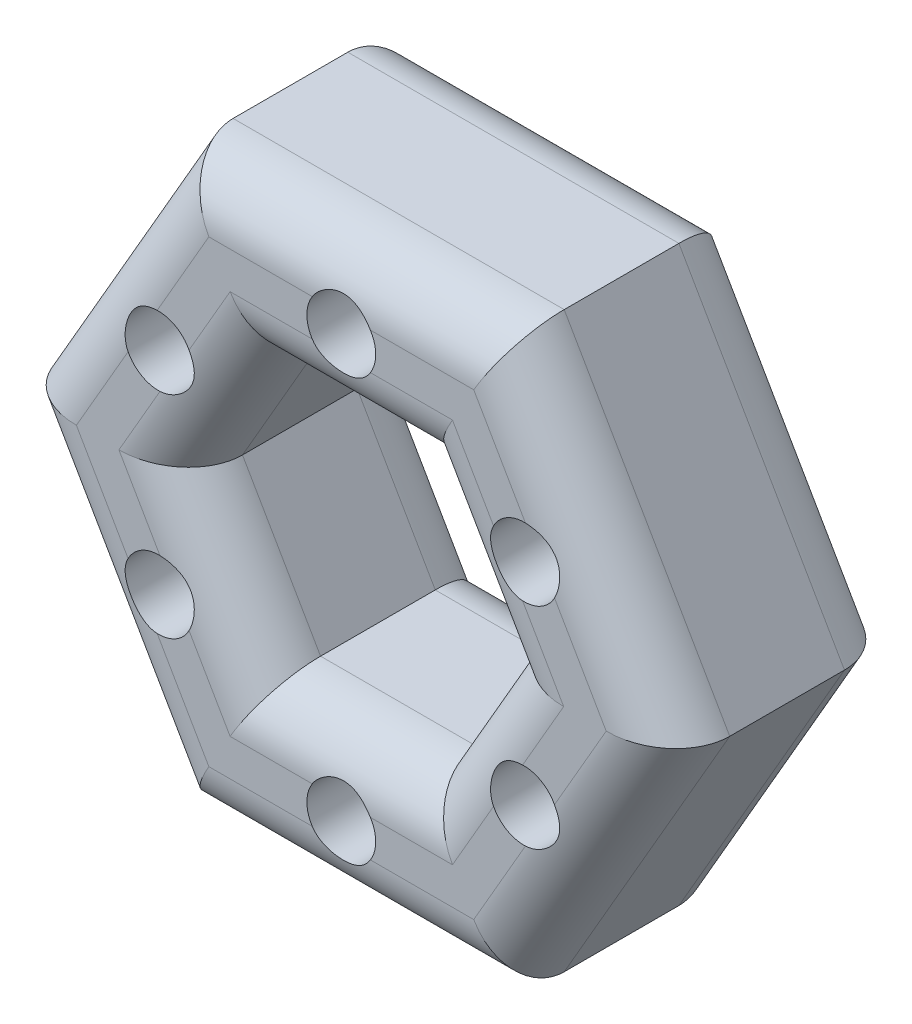
from build123d import *

# Parameters (mm, degrees)
SZKIC1_R                    = 6
DODANIE_WYCI_GNI_CIE1_DEPTH = 20
ZAOKR_GLENIE1_R             = 10


with BuildPart() as part:
    # Szkic1 → Dodanie-wyciągnięcie1 (new, symmetric)
    with BuildSketch(Plane.XY):
        Polygon((-28.867513459, 50), (28.867513459, 50), (57.735026919, 0), (28.867513459, -50), (-28.867513459, -50), (-57.735026919, 0), align=None)
        with Locations((0, 36.79)):
            Circle(SZKIC1_R, mode=Mode.SUBTRACT)
        with Locations((31.861074605, 18.395)):
            Circle(SZKIC1_R, mode=Mode.SUBTRACT)
        with Locations((31.861074605, -18.395)):
            Circle(SZKIC1_R, mode=Mode.SUBTRACT)
        with Locations((0, -36.79)):
            Circle(SZKIC1_R, mode=Mode.SUBTRACT)
        with Locations((-31.861074605, -18.395)):
            Circle(SZKIC1_R, mode=Mode.SUBTRACT)
        with Locations((-31.861074605, 18.395)):
            Circle(SZKIC1_R, mode=Mode.SUBTRACT)
        Polygon((-13.613919347, 23.58), (13.613919347, 23.58), (27.227838695, 0), (13.613919347, -23.58), (-13.613919347, -23.58), (-27.227838695, 0), align=None, mode=Mode.SUBTRACT)
    extrude(amount=DODANIE_WYCI_GNI_CIE1_DEPTH, both=True)

    # Zaokrąglenie1
    # the kernel refuses this fillet: 10 mm, written as the material it takes off along each edge
    with BuildSketch(Plane(origin=(53.867513459, -50, 20), x_dir=(0, 1, 0), z_dir=(-1, 0, 0)), Plane(origin=(70.235026919, 21.650635095, 20), x_dir=(-0.8660254037844363, 0.5000000000000041, 0), z_dir=(-0.5000000000000041, -0.8660254037844363, 0)), Plane(origin=(16.367513459, 71.650635095, 20), x_dir=(-0.8660254037844399, -0.4999999999999978, 0), z_dir=(0.49999999999999784, -0.8660254037844399, 0)), Plane(origin=(-70.235026919, -21.650635095, 20), x_dir=(0.8660254037844328, -0.5000000000000102, 0), z_dir=(0.5000000000000102, 0.8660254037844328, 0)), Plane(origin=(-53.867513459, 50, -20), x_dir=(0, 0, 1), z_dir=(1, 0, 0)), Plane(origin=(16.367513459, 71.650635095, -20), x_dir=(0, 0, 1), z_dir=(0.49999999999999784, -0.8660254037844399, 0)), Plane(origin=(70.235026919, 21.650635095, -20), x_dir=(0, 0, 1), z_dir=(-0.5000000000000041, -0.8660254037844363, 0)), Plane(origin=(-16.367513459, -71.650635095, 20), x_dir=(0.8660254037844433, 0.499999999999992, 0), z_dir=(-0.499999999999992, 0.8660254037844433, 0)), Plane(origin=(53.867513459, -50, -20), x_dir=(0, 0, 1), z_dir=(-1, 0, 0)), Plane(origin=(-16.367513459, -71.650635095, -20), x_dir=(0, 0, 1), z_dir=(-0.499999999999992, 0.8660254037844433, 0))) as zaokr_glenie1_piece_1:
        with BuildLine():
            CenterArc((ZAOKR_GLENIE1_R, ZAOKR_GLENIE1_R), ZAOKR_GLENIE1_R, 180, 90)
            Line((0, ZAOKR_GLENIE1_R), (0, 0))
            Line((0, 0), (ZAOKR_GLENIE1_R, 0))
        make_face()
    extrude(amount=107.735026919, mode=Mode.SUBTRACT)
    with BuildSketch(Plane(origin=(-53.867513459, 50, 20), x_dir=(0, 0, -1), z_dir=(1, 0, 0)), Plane(origin=(-70.235026919, -21.650635095, -20), x_dir=(0.8660254037844328, -0.5000000000000102, 0), z_dir=(0.5000000000000102, 0.8660254037844328, 0))) as zaokr_glenie1_piece_2:
        with BuildLine():
            CenterArc((ZAOKR_GLENIE1_R, -ZAOKR_GLENIE1_R), ZAOKR_GLENIE1_R, 90, 90)
            Line((0, -ZAOKR_GLENIE1_R), (0, 0))
            Line((0, 0), (ZAOKR_GLENIE1_R, 0))
        make_face()
    extrude(amount=107.735026919, mode=Mode.SUBTRACT)
    with BuildSketch(Plane(origin=(-39.727838695, -21.650635095, -20), x_dir=(0, 0, 1), z_dir=(0.5000000000000001, 0.8660254037844386, 0))) as zaokr_glenie1_piece_3_section:
        with BuildLine():
            CenterArc((ZAOKR_GLENIE1_R, -ZAOKR_GLENIE1_R), ZAOKR_GLENIE1_R, 90, 90)
            Line((0, -ZAOKR_GLENIE1_R), (0, 0))
            Line((0, 0), (ZAOKR_GLENIE1_R, 0))
        make_face()
    zaokr_glenie1_piece_3 = extrude(amount=77.227838695, mode=Mode.PRIVATE)
    zaokr_glenie1_piece_3 = split(zaokr_glenie1_piece_3, bisect_by=Plane(origin=(-22.192693606, 23.58, -17.607241167), z_dir=(0, -1, 0)), keep=Keep.TOP, mode=Mode.PRIVATE)
    zaokr_glenie1_piece_3 = split(zaokr_glenie1_piece_3, bisect_by=Plane(origin=(-31.517225824, 7.429436442, -17.607241167), z_dir=(0.8660254037844386, 0.5000000000000002, 0)), keep=Keep.TOP, mode=Mode.PRIVATE)
    add(zaokr_glenie1_piece_3, mode=Mode.SUBTRACT)
    with BuildSketch(Plane(origin=(-1.113919347, -45.230635095, -20), x_dir=(0, 0, 1), z_dir=(-0.5000000000000002, 0.8660254037844386, 0))) as zaokr_glenie1_piece_4_section:
        with BuildLine():
            CenterArc((ZAOKR_GLENIE1_R, -ZAOKR_GLENIE1_R), ZAOKR_GLENIE1_R, 90, 90)
            Line((0, -ZAOKR_GLENIE1_R), (0, 0))
            Line((0, 0), (ZAOKR_GLENIE1_R, 0))
        make_face()
    zaokr_glenie1_piece_4 = extrude(amount=77.227838695, mode=Mode.PRIVATE)
    zaokr_glenie1_piece_4 = split(zaokr_glenie1_piece_4, bisect_by=Plane(origin=(-22.192693606, -23.58, -17.607241167), z_dir=(0, 1, 0)), keep=Keep.TOP, mode=Mode.PRIVATE)
    zaokr_glenie1_piece_4 = split(zaokr_glenie1_piece_4, bisect_by=Plane(origin=(-31.517225824, -7.429436442, -17.607241167), z_dir=(0.8660254037844386, -0.5000000000000001, 0)), keep=Keep.TOP, mode=Mode.PRIVATE)
    add(zaokr_glenie1_piece_4, mode=Mode.SUBTRACT)
    with BuildSketch(Plane(origin=(38.613919347, -23.58, -20), x_dir=(0, 0, 1), z_dir=(-1, 0, 0))) as zaokr_glenie1_piece_5_section:
        with BuildLine():
            CenterArc((ZAOKR_GLENIE1_R, -ZAOKR_GLENIE1_R), ZAOKR_GLENIE1_R, 90, 90)
            Line((0, -ZAOKR_GLENIE1_R), (0, 0))
            Line((0, 0), (ZAOKR_GLENIE1_R, 0))
        make_face()
    zaokr_glenie1_piece_5 = extrude(amount=77.227838695, mode=Mode.PRIVATE)
    zaokr_glenie1_piece_5 = split(zaokr_glenie1_piece_5, bisect_by=Plane(origin=(9.324532218, -31.009436442, -17.607241167), z_dir=(-0.8660254037844386, 0.5000000000000001, 0)), keep=Keep.TOP, mode=Mode.PRIVATE)
    zaokr_glenie1_piece_5 = split(zaokr_glenie1_piece_5, bisect_by=Plane(origin=(-9.324532218, -31.009436442, -17.607241167), z_dir=(0.8660254037844386, 0.5000000000000002, 0)), keep=Keep.TOP, mode=Mode.PRIVATE)
    add(zaokr_glenie1_piece_5, mode=Mode.SUBTRACT)
    with BuildSketch(Plane(origin=(39.727838695, 21.650635095, -20), x_dir=(0, 0, 1), z_dir=(-0.5000000000000001, -0.8660254037844386, 0))) as zaokr_glenie1_piece_6_section:
        with BuildLine():
            CenterArc((ZAOKR_GLENIE1_R, -ZAOKR_GLENIE1_R), ZAOKR_GLENIE1_R, 90, 90)
            Line((0, -ZAOKR_GLENIE1_R), (0, 0))
            Line((0, 0), (ZAOKR_GLENIE1_R, 0))
        make_face()
    zaokr_glenie1_piece_6 = extrude(amount=77.227838695, mode=Mode.PRIVATE)
    zaokr_glenie1_piece_6 = split(zaokr_glenie1_piece_6, bisect_by=Plane(origin=(31.517225824, -7.429436442, -17.607241167), z_dir=(-0.8660254037844387, -0.5000000000000001, 0)), keep=Keep.TOP, mode=Mode.PRIVATE)
    zaokr_glenie1_piece_6 = split(zaokr_glenie1_piece_6, bisect_by=Plane(origin=(22.192693606, -23.58, -17.607241167), z_dir=(0, 1, 0)), keep=Keep.TOP, mode=Mode.PRIVATE)
    add(zaokr_glenie1_piece_6, mode=Mode.SUBTRACT)
    with BuildSketch(Plane(origin=(1.113919347, 45.230635095, -20), x_dir=(0, 0, 1), z_dir=(0.5000000000000001, -0.8660254037844387, 0))) as zaokr_glenie1_piece_7_section:
        with BuildLine():
            CenterArc((ZAOKR_GLENIE1_R, -ZAOKR_GLENIE1_R), ZAOKR_GLENIE1_R, 90, 90)
            Line((0, -ZAOKR_GLENIE1_R), (0, 0))
            Line((0, 0), (ZAOKR_GLENIE1_R, 0))
        make_face()
    zaokr_glenie1_piece_7 = extrude(amount=77.227838695, mode=Mode.PRIVATE)
    zaokr_glenie1_piece_7 = split(zaokr_glenie1_piece_7, bisect_by=Plane(origin=(22.192693606, 23.58, -17.607241167), z_dir=(0, -1, 0)), keep=Keep.TOP, mode=Mode.PRIVATE)
    zaokr_glenie1_piece_7 = split(zaokr_glenie1_piece_7, bisect_by=Plane(origin=(31.517225824, 7.429436442, -17.607241167), z_dir=(-0.8660254037844386, 0.5000000000000001, 0)), keep=Keep.TOP, mode=Mode.PRIVATE)
    add(zaokr_glenie1_piece_7, mode=Mode.SUBTRACT)
    with BuildSketch(Plane(origin=(-38.613919347, 23.58, -20), x_dir=(0, 0, 1), z_dir=(1, 0, 0))) as zaokr_glenie1_piece_8_section:
        with BuildLine():
            CenterArc((ZAOKR_GLENIE1_R, -ZAOKR_GLENIE1_R), ZAOKR_GLENIE1_R, 90, 90)
            Line((0, -ZAOKR_GLENIE1_R), (0, 0))
            Line((0, 0), (ZAOKR_GLENIE1_R, 0))
        make_face()
    zaokr_glenie1_piece_8 = extrude(amount=77.227838695, mode=Mode.PRIVATE)
    zaokr_glenie1_piece_8 = split(zaokr_glenie1_piece_8, bisect_by=Plane(origin=(-9.324532218, 31.009436442, -17.607241167), z_dir=(0.8660254037844386, -0.5000000000000001, 0)), keep=Keep.TOP, mode=Mode.PRIVATE)
    zaokr_glenie1_piece_8 = split(zaokr_glenie1_piece_8, bisect_by=Plane(origin=(9.324532218, 31.009436442, -17.607241167), z_dir=(-0.8660254037844387, -0.5000000000000001, 0)), keep=Keep.TOP, mode=Mode.PRIVATE)
    add(zaokr_glenie1_piece_8, mode=Mode.SUBTRACT)
    with BuildSketch(Plane(origin=(-39.727838695, -21.650635095, 20), x_dir=(-0.8660254037844385, 0.5000000000000001, 0), z_dir=(0.5000000000000001, 0.8660254037844386, 0))) as zaokr_glenie1_piece_9_section:
        with BuildLine():
            CenterArc((ZAOKR_GLENIE1_R, -ZAOKR_GLENIE1_R), ZAOKR_GLENIE1_R, 90, 90)
            Line((0, -ZAOKR_GLENIE1_R), (0, 0))
            Line((0, 0), (ZAOKR_GLENIE1_R, 0))
        make_face()
    zaokr_glenie1_piece_9 = extrude(amount=77.227838695, mode=Mode.PRIVATE)
    zaokr_glenie1_piece_9 = split(zaokr_glenie1_piece_9, bisect_by=Plane(origin=(-22.192693606, 23.58, 17.607241167), z_dir=(0, -1, 0)), keep=Keep.TOP, mode=Mode.PRIVATE)
    zaokr_glenie1_piece_9 = split(zaokr_glenie1_piece_9, bisect_by=Plane(origin=(-31.517225824, 7.429436442, 17.607241167), z_dir=(0.8660254037844386, 0.5000000000000002, 0)), keep=Keep.TOP, mode=Mode.PRIVATE)
    add(zaokr_glenie1_piece_9, mode=Mode.SUBTRACT)
    with BuildSketch(Plane(origin=(-1.113919347, -45.230635095, 20), x_dir=(-0.8660254037844385, -0.5000000000000002, 0), z_dir=(-0.5000000000000002, 0.8660254037844386, 0))) as zaokr_glenie1_piece_10_section:
        with BuildLine():
            CenterArc((ZAOKR_GLENIE1_R, -ZAOKR_GLENIE1_R), ZAOKR_GLENIE1_R, 90, 90)
            Line((0, -ZAOKR_GLENIE1_R), (0, 0))
            Line((0, 0), (ZAOKR_GLENIE1_R, 0))
        make_face()
    zaokr_glenie1_piece_10 = extrude(amount=77.227838695, mode=Mode.PRIVATE)
    zaokr_glenie1_piece_10 = split(zaokr_glenie1_piece_10, bisect_by=Plane(origin=(-22.192693606, -23.58, 17.607241167), z_dir=(0, 1, 0)), keep=Keep.TOP, mode=Mode.PRIVATE)
    zaokr_glenie1_piece_10 = split(zaokr_glenie1_piece_10, bisect_by=Plane(origin=(-31.517225824, -7.429436442, 17.607241167), z_dir=(0.8660254037844386, -0.5000000000000001, 0)), keep=Keep.TOP, mode=Mode.PRIVATE)
    add(zaokr_glenie1_piece_10, mode=Mode.SUBTRACT)
    with BuildSketch(Plane(origin=(38.613919347, -23.58, 20), x_dir=(0, -1, 0), z_dir=(-1, 0, 0))) as zaokr_glenie1_piece_11_section:
        with BuildLine():
            CenterArc((ZAOKR_GLENIE1_R, -ZAOKR_GLENIE1_R), ZAOKR_GLENIE1_R, 90, 90)
            Line((0, -ZAOKR_GLENIE1_R), (0, 0))
            Line((0, 0), (ZAOKR_GLENIE1_R, 0))
        make_face()
    zaokr_glenie1_piece_11 = extrude(amount=77.227838695, mode=Mode.PRIVATE)
    zaokr_glenie1_piece_11 = split(zaokr_glenie1_piece_11, bisect_by=Plane(origin=(9.324532218, -31.009436442, 17.607241167), z_dir=(-0.8660254037844386, 0.5000000000000001, 0)), keep=Keep.TOP, mode=Mode.PRIVATE)
    zaokr_glenie1_piece_11 = split(zaokr_glenie1_piece_11, bisect_by=Plane(origin=(-9.324532218, -31.009436442, 17.607241167), z_dir=(0.8660254037844386, 0.5000000000000002, 0)), keep=Keep.TOP, mode=Mode.PRIVATE)
    add(zaokr_glenie1_piece_11, mode=Mode.SUBTRACT)
    with BuildSketch(Plane(origin=(39.727838695, 21.650635095, 20), x_dir=(0.8660254037844385, -0.5000000000000001, 0), z_dir=(-0.5000000000000001, -0.8660254037844386, 0))) as zaokr_glenie1_piece_12_section:
        with BuildLine():
            CenterArc((ZAOKR_GLENIE1_R, -ZAOKR_GLENIE1_R), ZAOKR_GLENIE1_R, 90, 90)
            Line((0, -ZAOKR_GLENIE1_R), (0, 0))
            Line((0, 0), (ZAOKR_GLENIE1_R, 0))
        make_face()
    zaokr_glenie1_piece_12 = extrude(amount=77.227838695, mode=Mode.PRIVATE)
    zaokr_glenie1_piece_12 = split(zaokr_glenie1_piece_12, bisect_by=Plane(origin=(31.517225824, -7.429436442, 17.607241167), z_dir=(-0.8660254037844387, -0.5000000000000001, 0)), keep=Keep.TOP, mode=Mode.PRIVATE)
    zaokr_glenie1_piece_12 = split(zaokr_glenie1_piece_12, bisect_by=Plane(origin=(22.192693606, -23.58, 17.607241167), z_dir=(0, 1, 0)), keep=Keep.TOP, mode=Mode.PRIVATE)
    add(zaokr_glenie1_piece_12, mode=Mode.SUBTRACT)
    with BuildSketch(Plane(origin=(1.113919347, 45.230635095, 20), x_dir=(0.8660254037844386, 0.5, 0), z_dir=(0.5000000000000001, -0.8660254037844387, 0))) as zaokr_glenie1_piece_13_section:
        with BuildLine():
            CenterArc((ZAOKR_GLENIE1_R, -ZAOKR_GLENIE1_R), ZAOKR_GLENIE1_R, 90, 90)
            Line((0, -ZAOKR_GLENIE1_R), (0, 0))
            Line((0, 0), (ZAOKR_GLENIE1_R, 0))
        make_face()
    zaokr_glenie1_piece_13 = extrude(amount=77.227838695, mode=Mode.PRIVATE)
    zaokr_glenie1_piece_13 = split(zaokr_glenie1_piece_13, bisect_by=Plane(origin=(22.192693606, 23.58, 17.607241167), z_dir=(0, -1, 0)), keep=Keep.TOP, mode=Mode.PRIVATE)
    zaokr_glenie1_piece_13 = split(zaokr_glenie1_piece_13, bisect_by=Plane(origin=(31.517225824, 7.429436442, 17.607241167), z_dir=(-0.8660254037844386, 0.5000000000000001, 0)), keep=Keep.TOP, mode=Mode.PRIVATE)
    add(zaokr_glenie1_piece_13, mode=Mode.SUBTRACT)
    with BuildSketch(Plane(origin=(-38.613919347, 23.58, 20), x_dir=(0, 1, 0), z_dir=(1, 0, 0))) as zaokr_glenie1_piece_14_section:
        with BuildLine():
            CenterArc((ZAOKR_GLENIE1_R, -ZAOKR_GLENIE1_R), ZAOKR_GLENIE1_R, 90, 90)
            Line((0, -ZAOKR_GLENIE1_R), (0, 0))
            Line((0, 0), (ZAOKR_GLENIE1_R, 0))
        make_face()
    zaokr_glenie1_piece_14 = extrude(amount=77.227838695, mode=Mode.PRIVATE)
    zaokr_glenie1_piece_14 = split(zaokr_glenie1_piece_14, bisect_by=Plane(origin=(-9.324532218, 31.009436442, 17.607241167), z_dir=(0.8660254037844386, -0.5000000000000001, 0)), keep=Keep.TOP, mode=Mode.PRIVATE)
    zaokr_glenie1_piece_14 = split(zaokr_glenie1_piece_14, bisect_by=Plane(origin=(9.324532218, 31.009436442, 17.607241167), z_dir=(-0.8660254037844387, -0.5000000000000001, 0)), keep=Keep.TOP, mode=Mode.PRIVATE)
    add(zaokr_glenie1_piece_14, mode=Mode.SUBTRACT)
    with BuildSketch(Plane(origin=(-1.113919347, -45.230635095, -20), x_dir=(0, 0, 1), z_dir=(-0.5000000000000002, 0.8660254037844386, 0))) as zaokr_glenie1_piece_15a_section:
        with BuildLine():
            CenterArc((ZAOKR_GLENIE1_R, -ZAOKR_GLENIE1_R), ZAOKR_GLENIE1_R, 90, 90)
            Line((0, -ZAOKR_GLENIE1_R), (0, 0))
            Line((0, 0), (ZAOKR_GLENIE1_R, 0))
        make_face()
    zaokr_glenie1_piece_15a = extrude(amount=77.227838695, mode=Mode.PRIVATE)
    zaokr_glenie1_piece_15a = split(zaokr_glenie1_piece_15a, bisect_by=Plane(origin=(-25.29807353, 3.342451312, -17.796306899), z_dir=(-0.8660254037844386, 0.5000000000000001, 0)), keep=Keep.TOP, mode=Mode.PRIVATE)
    with BuildSketch(Plane(origin=(-39.727838695, -21.650635095, -20), x_dir=(0, 0, 1), z_dir=(0.5000000000000001, 0.8660254037844386, 0))) as zaokr_glenie1_piece_15b_section:
        with BuildLine():
            CenterArc((ZAOKR_GLENIE1_R, -ZAOKR_GLENIE1_R), ZAOKR_GLENIE1_R, 90, 90)
            Line((0, -ZAOKR_GLENIE1_R), (0, 0))
            Line((0, 0), (ZAOKR_GLENIE1_R, 0))
        make_face()
    zaokr_glenie1_piece_15b = extrude(amount=77.227838695, mode=Mode.PRIVATE)
    zaokr_glenie1_piece_15b = split(zaokr_glenie1_piece_15b, bisect_by=Plane(origin=(-25.29807353, -3.342451312, -17.796306899), z_dir=(-0.8660254037844386, -0.5000000000000002, 0)), keep=Keep.TOP, mode=Mode.PRIVATE)
    zaokr_glenie1_piece_15 = zaokr_glenie1_piece_15a & zaokr_glenie1_piece_15b
    add(zaokr_glenie1_piece_15, mode=Mode.SUBTRACT)
    with BuildSketch(Plane(origin=(-38.613919347, 23.58, -20), x_dir=(0, 0, 1), z_dir=(1, 0, 0))) as zaokr_glenie1_piece_16a_section:
        with BuildLine():
            CenterArc((ZAOKR_GLENIE1_R, -ZAOKR_GLENIE1_R), ZAOKR_GLENIE1_R, 90, 90)
            Line((0, -ZAOKR_GLENIE1_R), (0, 0))
            Line((0, 0), (ZAOKR_GLENIE1_R, 0))
        make_face()
    zaokr_glenie1_piece_16a = extrude(amount=77.227838695, mode=Mode.PRIVATE)
    zaokr_glenie1_piece_16a = split(zaokr_glenie1_piece_16a, bisect_by=Plane(origin=(-15.543684512, 20.237548688, -17.796306899), z_dir=(-0.8660254037844386, 0.5000000000000001, 0)), keep=Keep.TOP, mode=Mode.PRIVATE)
    with BuildSketch(Plane(origin=(-39.727838695, -21.650635095, -20), x_dir=(0, 0, 1), z_dir=(0.5000000000000001, 0.8660254037844386, 0))) as zaokr_glenie1_piece_16b_section:
        with BuildLine():
            CenterArc((ZAOKR_GLENIE1_R, -ZAOKR_GLENIE1_R), ZAOKR_GLENIE1_R, 90, 90)
            Line((0, -ZAOKR_GLENIE1_R), (0, 0))
            Line((0, 0), (ZAOKR_GLENIE1_R, 0))
        make_face()
    zaokr_glenie1_piece_16b = extrude(amount=77.227838695, mode=Mode.PRIVATE)
    zaokr_glenie1_piece_16b = split(zaokr_glenie1_piece_16b, bisect_by=Plane(origin=(-9.754389018, 23.58, -17.796306899), z_dir=(0, 1, 0)), keep=Keep.TOP, mode=Mode.PRIVATE)
    zaokr_glenie1_piece_16 = zaokr_glenie1_piece_16a & zaokr_glenie1_piece_16b
    add(zaokr_glenie1_piece_16, mode=Mode.SUBTRACT)
    with BuildSketch(Plane(origin=(38.613919347, -23.58, -20), x_dir=(0, 0, 1), z_dir=(-1, 0, 0))) as zaokr_glenie1_piece_17a_section:
        with BuildLine():
            CenterArc((ZAOKR_GLENIE1_R, -ZAOKR_GLENIE1_R), ZAOKR_GLENIE1_R, 90, 90)
            Line((0, -ZAOKR_GLENIE1_R), (0, 0))
            Line((0, 0), (ZAOKR_GLENIE1_R, 0))
        make_face()
    zaokr_glenie1_piece_17a = extrude(amount=77.227838695, mode=Mode.PRIVATE)
    zaokr_glenie1_piece_17a = split(zaokr_glenie1_piece_17a, bisect_by=Plane(origin=(-15.543684512, -20.237548688, -17.796306899), z_dir=(-0.8660254037844386, -0.5000000000000002, 0)), keep=Keep.TOP, mode=Mode.PRIVATE)
    with BuildSketch(Plane(origin=(-1.113919347, -45.230635095, -20), x_dir=(0, 0, 1), z_dir=(-0.5000000000000002, 0.8660254037844386, 0))) as zaokr_glenie1_piece_17b_section:
        with BuildLine():
            CenterArc((ZAOKR_GLENIE1_R, -ZAOKR_GLENIE1_R), ZAOKR_GLENIE1_R, 90, 90)
            Line((0, -ZAOKR_GLENIE1_R), (0, 0))
            Line((0, 0), (ZAOKR_GLENIE1_R, 0))
        make_face()
    zaokr_glenie1_piece_17b = extrude(amount=77.227838695, mode=Mode.PRIVATE)
    zaokr_glenie1_piece_17b = split(zaokr_glenie1_piece_17b, bisect_by=Plane(origin=(-9.754389018, -23.58, -17.796306899), z_dir=(0, -1, 0)), keep=Keep.TOP, mode=Mode.PRIVATE)
    zaokr_glenie1_piece_17 = zaokr_glenie1_piece_17a & zaokr_glenie1_piece_17b
    add(zaokr_glenie1_piece_17, mode=Mode.SUBTRACT)
    with BuildSketch(Plane(origin=(39.727838695, 21.650635095, -20), x_dir=(0, 0, 1), z_dir=(-0.5000000000000001, -0.8660254037844386, 0))) as zaokr_glenie1_piece_18a_section:
        with BuildLine():
            CenterArc((ZAOKR_GLENIE1_R, -ZAOKR_GLENIE1_R), ZAOKR_GLENIE1_R, 90, 90)
            Line((0, -ZAOKR_GLENIE1_R), (0, 0))
            Line((0, 0), (ZAOKR_GLENIE1_R, 0))
        make_face()
    zaokr_glenie1_piece_18a = extrude(amount=77.227838695, mode=Mode.PRIVATE)
    zaokr_glenie1_piece_18a = split(zaokr_glenie1_piece_18a, bisect_by=Plane(origin=(9.754389018, -23.58, -17.796306899), z_dir=(0, -1, 0)), keep=Keep.TOP, mode=Mode.PRIVATE)
    with BuildSketch(Plane(origin=(38.613919347, -23.58, -20), x_dir=(0, 0, 1), z_dir=(-1, 0, 0))) as zaokr_glenie1_piece_18b_section:
        with BuildLine():
            CenterArc((ZAOKR_GLENIE1_R, -ZAOKR_GLENIE1_R), ZAOKR_GLENIE1_R, 90, 90)
            Line((0, -ZAOKR_GLENIE1_R), (0, 0))
            Line((0, 0), (ZAOKR_GLENIE1_R, 0))
        make_face()
    zaokr_glenie1_piece_18b = extrude(amount=77.227838695, mode=Mode.PRIVATE)
    zaokr_glenie1_piece_18b = split(zaokr_glenie1_piece_18b, bisect_by=Plane(origin=(15.543684512, -20.237548688, -17.796306899), z_dir=(0.8660254037844386, -0.5000000000000001, 0)), keep=Keep.TOP, mode=Mode.PRIVATE)
    zaokr_glenie1_piece_18 = zaokr_glenie1_piece_18a & zaokr_glenie1_piece_18b
    add(zaokr_glenie1_piece_18, mode=Mode.SUBTRACT)
    with BuildSketch(Plane(origin=(1.113919347, 45.230635095, -20), x_dir=(0, 0, 1), z_dir=(0.5000000000000001, -0.8660254037844387, 0))) as zaokr_glenie1_piece_19a_section:
        with BuildLine():
            CenterArc((ZAOKR_GLENIE1_R, -ZAOKR_GLENIE1_R), ZAOKR_GLENIE1_R, 90, 90)
            Line((0, -ZAOKR_GLENIE1_R), (0, 0))
            Line((0, 0), (ZAOKR_GLENIE1_R, 0))
        make_face()
    zaokr_glenie1_piece_19a = extrude(amount=77.227838695, mode=Mode.PRIVATE)
    zaokr_glenie1_piece_19a = split(zaokr_glenie1_piece_19a, bisect_by=Plane(origin=(25.29807353, -3.342451312, -17.796306899), z_dir=(0.8660254037844386, -0.5000000000000001, 0)), keep=Keep.TOP, mode=Mode.PRIVATE)
    with BuildSketch(Plane(origin=(39.727838695, 21.650635095, -20), x_dir=(0, 0, 1), z_dir=(-0.5000000000000001, -0.8660254037844386, 0))) as zaokr_glenie1_piece_19b_section:
        with BuildLine():
            CenterArc((ZAOKR_GLENIE1_R, -ZAOKR_GLENIE1_R), ZAOKR_GLENIE1_R, 90, 90)
            Line((0, -ZAOKR_GLENIE1_R), (0, 0))
            Line((0, 0), (ZAOKR_GLENIE1_R, 0))
        make_face()
    zaokr_glenie1_piece_19b = extrude(amount=77.227838695, mode=Mode.PRIVATE)
    zaokr_glenie1_piece_19b = split(zaokr_glenie1_piece_19b, bisect_by=Plane(origin=(25.29807353, 3.342451312, -17.796306899), z_dir=(0.8660254037844387, 0.5000000000000001, 0)), keep=Keep.TOP, mode=Mode.PRIVATE)
    zaokr_glenie1_piece_19 = zaokr_glenie1_piece_19a & zaokr_glenie1_piece_19b
    add(zaokr_glenie1_piece_19, mode=Mode.SUBTRACT)
    with BuildSketch(Plane(origin=(-38.613919347, 23.58, -20), x_dir=(0, 0, 1), z_dir=(1, 0, 0))) as zaokr_glenie1_piece_20a_section:
        with BuildLine():
            CenterArc((ZAOKR_GLENIE1_R, -ZAOKR_GLENIE1_R), ZAOKR_GLENIE1_R, 90, 90)
            Line((0, -ZAOKR_GLENIE1_R), (0, 0))
            Line((0, 0), (ZAOKR_GLENIE1_R, 0))
        make_face()
    zaokr_glenie1_piece_20a = extrude(amount=77.227838695, mode=Mode.PRIVATE)
    zaokr_glenie1_piece_20a = split(zaokr_glenie1_piece_20a, bisect_by=Plane(origin=(15.543684512, 20.237548688, -17.796306899), z_dir=(0.8660254037844387, 0.5000000000000001, 0)), keep=Keep.TOP, mode=Mode.PRIVATE)
    with BuildSketch(Plane(origin=(1.113919347, 45.230635095, -20), x_dir=(0, 0, 1), z_dir=(0.5000000000000001, -0.8660254037844387, 0))) as zaokr_glenie1_piece_20b_section:
        with BuildLine():
            CenterArc((ZAOKR_GLENIE1_R, -ZAOKR_GLENIE1_R), ZAOKR_GLENIE1_R, 90, 90)
            Line((0, -ZAOKR_GLENIE1_R), (0, 0))
            Line((0, 0), (ZAOKR_GLENIE1_R, 0))
        make_face()
    zaokr_glenie1_piece_20b = extrude(amount=77.227838695, mode=Mode.PRIVATE)
    zaokr_glenie1_piece_20b = split(zaokr_glenie1_piece_20b, bisect_by=Plane(origin=(9.754389018, 23.58, -17.796306899), z_dir=(0, 1, 0)), keep=Keep.TOP, mode=Mode.PRIVATE)
    zaokr_glenie1_piece_20 = zaokr_glenie1_piece_20a & zaokr_glenie1_piece_20b
    add(zaokr_glenie1_piece_20, mode=Mode.SUBTRACT)
    with BuildSketch(Plane(origin=(-39.727838695, -21.650635095, 20), x_dir=(-0.8660254037844385, 0.5000000000000001, 0), z_dir=(0.5000000000000001, 0.8660254037844386, 0))) as zaokr_glenie1_piece_21a_section:
        with BuildLine():
            CenterArc((ZAOKR_GLENIE1_R, -ZAOKR_GLENIE1_R), ZAOKR_GLENIE1_R, 90, 90)
            Line((0, -ZAOKR_GLENIE1_R), (0, 0))
            Line((0, 0), (ZAOKR_GLENIE1_R, 0))
        make_face()
    zaokr_glenie1_piece_21a = extrude(amount=77.227838695, mode=Mode.PRIVATE)
    zaokr_glenie1_piece_21a = split(zaokr_glenie1_piece_21a, bisect_by=Plane(origin=(-25.29807353, -3.342451312, 17.796306899), z_dir=(-0.8660254037844386, -0.5000000000000002, 0)), keep=Keep.TOP, mode=Mode.PRIVATE)
    with BuildSketch(Plane(origin=(-1.113919347, -45.230635095, 20), x_dir=(-0.8660254037844385, -0.5000000000000002, 0), z_dir=(-0.5000000000000002, 0.8660254037844386, 0))) as zaokr_glenie1_piece_21b_section:
        with BuildLine():
            CenterArc((ZAOKR_GLENIE1_R, -ZAOKR_GLENIE1_R), ZAOKR_GLENIE1_R, 90, 90)
            Line((0, -ZAOKR_GLENIE1_R), (0, 0))
            Line((0, 0), (ZAOKR_GLENIE1_R, 0))
        make_face()
    zaokr_glenie1_piece_21b = extrude(amount=77.227838695, mode=Mode.PRIVATE)
    zaokr_glenie1_piece_21b = split(zaokr_glenie1_piece_21b, bisect_by=Plane(origin=(-25.29807353, 3.342451312, 17.796306899), z_dir=(-0.8660254037844386, 0.5000000000000001, 0)), keep=Keep.TOP, mode=Mode.PRIVATE)
    zaokr_glenie1_piece_21 = zaokr_glenie1_piece_21a & zaokr_glenie1_piece_21b
    add(zaokr_glenie1_piece_21, mode=Mode.SUBTRACT)
    with BuildSketch(Plane(origin=(-39.727838695, -21.650635095, 20), x_dir=(-0.8660254037844385, 0.5000000000000001, 0), z_dir=(0.5000000000000001, 0.8660254037844386, 0))) as zaokr_glenie1_piece_22a_section:
        with BuildLine():
            CenterArc((ZAOKR_GLENIE1_R, -ZAOKR_GLENIE1_R), ZAOKR_GLENIE1_R, 90, 90)
            Line((0, -ZAOKR_GLENIE1_R), (0, 0))
            Line((0, 0), (ZAOKR_GLENIE1_R, 0))
        make_face()
    zaokr_glenie1_piece_22a = extrude(amount=77.227838695, mode=Mode.PRIVATE)
    zaokr_glenie1_piece_22a = split(zaokr_glenie1_piece_22a, bisect_by=Plane(origin=(-9.754389018, 23.58, 17.796306899), z_dir=(0, 1, 0)), keep=Keep.TOP, mode=Mode.PRIVATE)
    with BuildSketch(Plane(origin=(-38.613919347, 23.58, 20), x_dir=(0, 1, 0), z_dir=(1, 0, 0))) as zaokr_glenie1_piece_22b_section:
        with BuildLine():
            CenterArc((ZAOKR_GLENIE1_R, -ZAOKR_GLENIE1_R), ZAOKR_GLENIE1_R, 90, 90)
            Line((0, -ZAOKR_GLENIE1_R), (0, 0))
            Line((0, 0), (ZAOKR_GLENIE1_R, 0))
        make_face()
    zaokr_glenie1_piece_22b = extrude(amount=77.227838695, mode=Mode.PRIVATE)
    zaokr_glenie1_piece_22b = split(zaokr_glenie1_piece_22b, bisect_by=Plane(origin=(-15.543684512, 20.237548688, 17.796306899), z_dir=(-0.8660254037844386, 0.5000000000000001, 0)), keep=Keep.TOP, mode=Mode.PRIVATE)
    zaokr_glenie1_piece_22 = zaokr_glenie1_piece_22a & zaokr_glenie1_piece_22b
    add(zaokr_glenie1_piece_22, mode=Mode.SUBTRACT)
    with BuildSketch(Plane(origin=(-1.113919347, -45.230635095, 20), x_dir=(-0.8660254037844385, -0.5000000000000002, 0), z_dir=(-0.5000000000000002, 0.8660254037844386, 0))) as zaokr_glenie1_piece_23a_section:
        with BuildLine():
            CenterArc((ZAOKR_GLENIE1_R, -ZAOKR_GLENIE1_R), ZAOKR_GLENIE1_R, 90, 90)
            Line((0, -ZAOKR_GLENIE1_R), (0, 0))
            Line((0, 0), (ZAOKR_GLENIE1_R, 0))
        make_face()
    zaokr_glenie1_piece_23a = extrude(amount=77.227838695, mode=Mode.PRIVATE)
    zaokr_glenie1_piece_23a = split(zaokr_glenie1_piece_23a, bisect_by=Plane(origin=(-9.754389018, -23.58, 17.796306899), z_dir=(0, -1, 0)), keep=Keep.TOP, mode=Mode.PRIVATE)
    with BuildSketch(Plane(origin=(38.613919347, -23.58, 20), x_dir=(0, -1, 0), z_dir=(-1, 0, 0))) as zaokr_glenie1_piece_23b_section:
        with BuildLine():
            CenterArc((ZAOKR_GLENIE1_R, -ZAOKR_GLENIE1_R), ZAOKR_GLENIE1_R, 90, 90)
            Line((0, -ZAOKR_GLENIE1_R), (0, 0))
            Line((0, 0), (ZAOKR_GLENIE1_R, 0))
        make_face()
    zaokr_glenie1_piece_23b = extrude(amount=77.227838695, mode=Mode.PRIVATE)
    zaokr_glenie1_piece_23b = split(zaokr_glenie1_piece_23b, bisect_by=Plane(origin=(-15.543684512, -20.237548688, 17.796306899), z_dir=(-0.8660254037844386, -0.5000000000000002, 0)), keep=Keep.TOP, mode=Mode.PRIVATE)
    zaokr_glenie1_piece_23 = zaokr_glenie1_piece_23a & zaokr_glenie1_piece_23b
    add(zaokr_glenie1_piece_23, mode=Mode.SUBTRACT)
    with BuildSketch(Plane(origin=(38.613919347, -23.58, 20), x_dir=(0, -1, 0), z_dir=(-1, 0, 0))) as zaokr_glenie1_piece_24a_section:
        with BuildLine():
            CenterArc((ZAOKR_GLENIE1_R, -ZAOKR_GLENIE1_R), ZAOKR_GLENIE1_R, 90, 90)
            Line((0, -ZAOKR_GLENIE1_R), (0, 0))
            Line((0, 0), (ZAOKR_GLENIE1_R, 0))
        make_face()
    zaokr_glenie1_piece_24a = extrude(amount=77.227838695, mode=Mode.PRIVATE)
    zaokr_glenie1_piece_24a = split(zaokr_glenie1_piece_24a, bisect_by=Plane(origin=(15.543684512, -20.237548688, 17.796306899), z_dir=(0.8660254037844386, -0.5000000000000001, 0)), keep=Keep.TOP, mode=Mode.PRIVATE)
    with BuildSketch(Plane(origin=(39.727838695, 21.650635095, 20), x_dir=(0.8660254037844385, -0.5000000000000001, 0), z_dir=(-0.5000000000000001, -0.8660254037844386, 0))) as zaokr_glenie1_piece_24b_section:
        with BuildLine():
            CenterArc((ZAOKR_GLENIE1_R, -ZAOKR_GLENIE1_R), ZAOKR_GLENIE1_R, 90, 90)
            Line((0, -ZAOKR_GLENIE1_R), (0, 0))
            Line((0, 0), (ZAOKR_GLENIE1_R, 0))
        make_face()
    zaokr_glenie1_piece_24b = extrude(amount=77.227838695, mode=Mode.PRIVATE)
    zaokr_glenie1_piece_24b = split(zaokr_glenie1_piece_24b, bisect_by=Plane(origin=(9.754389018, -23.58, 17.796306899), z_dir=(0, -1, 0)), keep=Keep.TOP, mode=Mode.PRIVATE)
    zaokr_glenie1_piece_24 = zaokr_glenie1_piece_24a & zaokr_glenie1_piece_24b
    add(zaokr_glenie1_piece_24, mode=Mode.SUBTRACT)
    with BuildSketch(Plane(origin=(39.727838695, 21.650635095, 20), x_dir=(0.8660254037844385, -0.5000000000000001, 0), z_dir=(-0.5000000000000001, -0.8660254037844386, 0))) as zaokr_glenie1_piece_25a_section:
        with BuildLine():
            CenterArc((ZAOKR_GLENIE1_R, -ZAOKR_GLENIE1_R), ZAOKR_GLENIE1_R, 90, 90)
            Line((0, -ZAOKR_GLENIE1_R), (0, 0))
            Line((0, 0), (ZAOKR_GLENIE1_R, 0))
        make_face()
    zaokr_glenie1_piece_25a = extrude(amount=77.227838695, mode=Mode.PRIVATE)
    zaokr_glenie1_piece_25a = split(zaokr_glenie1_piece_25a, bisect_by=Plane(origin=(25.29807353, 3.342451312, 17.796306899), z_dir=(0.8660254037844387, 0.5000000000000001, 0)), keep=Keep.TOP, mode=Mode.PRIVATE)
    with BuildSketch(Plane(origin=(1.113919347, 45.230635095, 20), x_dir=(0.8660254037844386, 0.5, 0), z_dir=(0.5000000000000001, -0.8660254037844387, 0))) as zaokr_glenie1_piece_25b_section:
        with BuildLine():
            CenterArc((ZAOKR_GLENIE1_R, -ZAOKR_GLENIE1_R), ZAOKR_GLENIE1_R, 90, 90)
            Line((0, -ZAOKR_GLENIE1_R), (0, 0))
            Line((0, 0), (ZAOKR_GLENIE1_R, 0))
        make_face()
    zaokr_glenie1_piece_25b = extrude(amount=77.227838695, mode=Mode.PRIVATE)
    zaokr_glenie1_piece_25b = split(zaokr_glenie1_piece_25b, bisect_by=Plane(origin=(25.29807353, -3.342451312, 17.796306899), z_dir=(0.8660254037844386, -0.5000000000000001, 0)), keep=Keep.TOP, mode=Mode.PRIVATE)
    zaokr_glenie1_piece_25 = zaokr_glenie1_piece_25a & zaokr_glenie1_piece_25b
    add(zaokr_glenie1_piece_25, mode=Mode.SUBTRACT)
    with BuildSketch(Plane(origin=(1.113919347, 45.230635095, 20), x_dir=(0.8660254037844386, 0.5, 0), z_dir=(0.5000000000000001, -0.8660254037844387, 0))) as zaokr_glenie1_piece_26a_section:
        with BuildLine():
            CenterArc((ZAOKR_GLENIE1_R, -ZAOKR_GLENIE1_R), ZAOKR_GLENIE1_R, 90, 90)
            Line((0, -ZAOKR_GLENIE1_R), (0, 0))
            Line((0, 0), (ZAOKR_GLENIE1_R, 0))
        make_face()
    zaokr_glenie1_piece_26a = extrude(amount=77.227838695, mode=Mode.PRIVATE)
    zaokr_glenie1_piece_26a = split(zaokr_glenie1_piece_26a, bisect_by=Plane(origin=(9.754389018, 23.58, 17.796306899), z_dir=(0, 1, 0)), keep=Keep.TOP, mode=Mode.PRIVATE)
    with BuildSketch(Plane(origin=(-38.613919347, 23.58, 20), x_dir=(0, 1, 0), z_dir=(1, 0, 0))) as zaokr_glenie1_piece_26b_section:
        with BuildLine():
            CenterArc((ZAOKR_GLENIE1_R, -ZAOKR_GLENIE1_R), ZAOKR_GLENIE1_R, 90, 90)
            Line((0, -ZAOKR_GLENIE1_R), (0, 0))
            Line((0, 0), (ZAOKR_GLENIE1_R, 0))
        make_face()
    zaokr_glenie1_piece_26b = extrude(amount=77.227838695, mode=Mode.PRIVATE)
    zaokr_glenie1_piece_26b = split(zaokr_glenie1_piece_26b, bisect_by=Plane(origin=(15.543684512, 20.237548688, 17.796306899), z_dir=(0.8660254037844387, 0.5000000000000001, 0)), keep=Keep.TOP, mode=Mode.PRIVATE)
    zaokr_glenie1_piece_26 = zaokr_glenie1_piece_26a & zaokr_glenie1_piece_26b
    add(zaokr_glenie1_piece_26, mode=Mode.SUBTRACT)


solid = part.part
